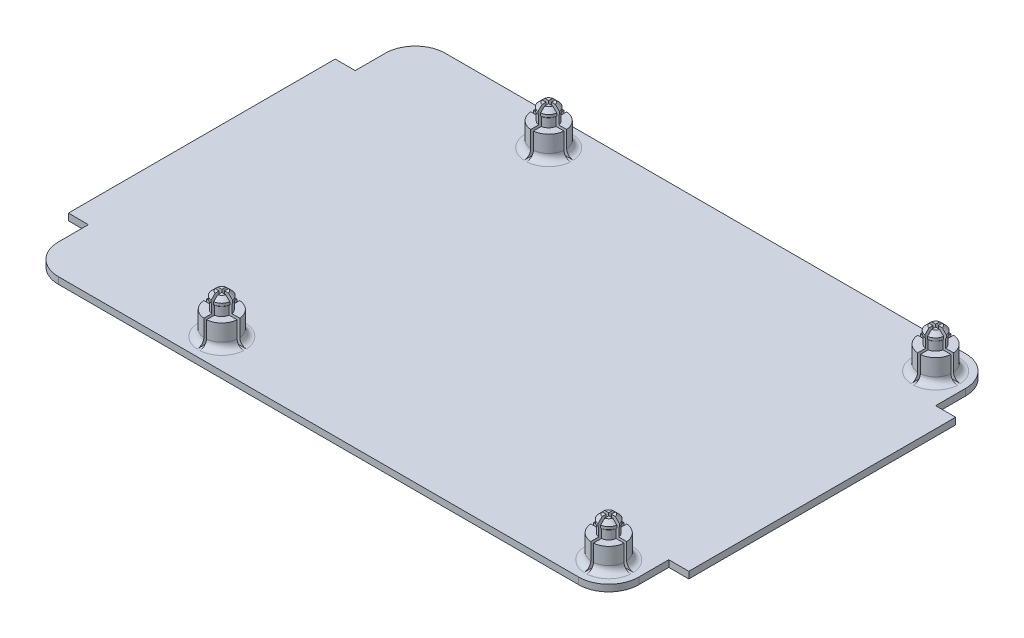
from build123d import *

# Parameters (mm, degrees)
SKETCH1_W           = 87
SKETCH1_H           = 58
BOSS_EXTRUDE1_DEPTH = 1
SKETCH2_R           = 2.5
BOSS_EXTRUDE2_DEPTH = 3.5
SKETCH3_R           = 1.325
BOSS_EXTRUDE3_DEPTH = 1.4
SKETCH4_R           = 1.425
BOSS_EXTRUDE4_DEPTH = 1
CHAMFER2_SIZE       = 0.1
CHAMFER1_SIZE       = 0.6
CUT_EXTRUDE1_REACH  = 54.734
SKETCH5_W           = 63
SKETCH5_H           = 0.4
SKETCH5_W_2         = 0.4
SKETCH5_H_2         = 54
FILLET2_R           = 1
FILLET3_R           = 4.5
SKETCH6_W           = 93
SKETCH6_H           = 40
BOSS_EXTRUDE5_DEPTH = 1


# Some blends are built 0.0001 mm under size
with BuildPart() as part:
    # Sketch1 → Boss-Extrude1 (new body)
    with BuildSketch(Plane(origin=(0, 0, 0), x_dir=(1, 0, 0), z_dir=(0, 1, 0))):
        Rectangle(SKETCH1_W, SKETCH1_H)
    extrude(amount=BOSS_EXTRUDE1_DEPTH)

    # Sketch2 → Boss-Extrude2 (add)
    with BuildSketch(Plane(origin=(0, 1, 0), x_dir=(1, 0, 0), z_dir=(0, 1, 0))):
        with Locations(Location((-19, 24.5, 0), (0, 0, 270))):
            Circle(SKETCH2_R)
        with Locations(Location((39, 24.5, 0), (0, 0, 270))):
            Circle(SKETCH2_R)
        with Locations(Location((39, -24.5, 0), (0, 0, 270))):
            Circle(SKETCH2_R)
        with Locations(Location((-19, -24.5, 0), (0, 0, 270))):
            Circle(SKETCH2_R)
    extrude(amount=BOSS_EXTRUDE2_DEPTH)

    # Sketch3 → Boss-Extrude3 (add)
    with BuildSketch(Plane(origin=(0, 4.5, 0), x_dir=(1, 0, 0), z_dir=(0, 1, 0))):
        with Locations(Location((-19, 24.5, 0), (0, 0, 270))):
            Circle(SKETCH3_R)
        with Locations(Location((39, 24.5, 0), (0, 0, 270))):
            Circle(SKETCH3_R)
        with Locations(Location((39, -24.5, 0), (0, 0, 270))):
            Circle(SKETCH3_R)
        with Locations(Location((-19, -24.5, 0), (0, 0, 270))):
            Circle(SKETCH3_R)
    extrude(amount=BOSS_EXTRUDE3_DEPTH)

    # Sketch4 → Boss-Extrude4 (add)
    with BuildSketch(Plane(origin=(0, 5.9, 0), x_dir=(1, 0, 0), z_dir=(0, 1, 0))):
        with Locations(Location((-19, 24.5, 0), (0, 0, 270))):
            Circle(SKETCH4_R)
        with Locations(Location((39, 24.5, 0), (0, 0, 270))):
            Circle(SKETCH4_R)
        with Locations(Location((39, -24.5, 0), (0, 0, 270))):
            Circle(SKETCH4_R)
        with Locations(Location((-19, -24.5, 0), (0, 0, 270))):
            Circle(SKETCH4_R)
    extrude(amount=BOSS_EXTRUDE4_DEPTH)

    # Chamfer2
    chamfer2_edges = [part.edges().sort_by_distance(p)[0] for p in [
        (-19, 5.9, -25.825),
        (39, 5.9, -25.825),
        (39, 5.9, 23.175),
        (-19, 5.9, 23.175),
    ]]
    chamfer(chamfer2_edges, length=CHAMFER2_SIZE - 0.0001)  # a hair under: the kernel refuses the full size

    # Chamfer1
    chamfer1_edges = [part.edges().sort_by_distance(p)[0] for p in [
        (-19, 6.9, -25.925),
        (39, 6.9, -25.925),
        (39, 6.9, 23.075),
        (-19, 6.9, 23.075),
    ]]
    chamfer(chamfer1_edges, length=CHAMFER1_SIZE)

    # Cut-Extrude1: up to this face of the body (flat: up to its plane)
    cut_extrude1_end = Plane(part.part.faces().sort_by_distance((-0.158108598, 1, 0))[0])
    # Sketch5 → Cut-Extrude1 (cut, up to the picked face)
    with BuildSketch(Plane(origin=(0, 6.9, 0), x_dir=(1, 0, 0), z_dir=(0, 1, 0)), mode=Mode.PRIVATE) as cut_extrude1_sk1:
        with Locations((10, 24.5)):
            Rectangle(SKETCH5_W, SKETCH5_H)
    cut_extrude1_tool1 = split(extrude(cut_extrude1_sk1.sketch, amount=-CUT_EXTRUDE1_REACH, mode=Mode.PRIVATE), bisect_by=cut_extrude1_end, keep=Keep.BOTH, mode=Mode.PRIVATE)
    # Sketch5 → Cut-Extrude1 (cut, up to the picked face)
    with BuildSketch(Plane(origin=(0, 6.9, 0), x_dir=(1, 0, 0), z_dir=(0, 1, 0)), mode=Mode.PRIVATE) as cut_extrude1_sk2:
        with Locations((-19, 0)):
            Rectangle(SKETCH5_W_2, SKETCH5_H_2)
    cut_extrude1_tool2 = split(extrude(cut_extrude1_sk2.sketch, amount=-CUT_EXTRUDE1_REACH, mode=Mode.PRIVATE), bisect_by=cut_extrude1_end, keep=Keep.BOTH, mode=Mode.PRIVATE)
    # Sketch5 → Cut-Extrude1 (cut, up to the picked face)
    with BuildSketch(Plane(origin=(0, 6.9, 0), x_dir=(1, 0, 0), z_dir=(0, 1, 0)), mode=Mode.PRIVATE) as cut_extrude1_sk3:
        with Locations((10, -24.5)):
            Rectangle(SKETCH5_W, SKETCH5_H)
    cut_extrude1_tool3 = split(extrude(cut_extrude1_sk3.sketch, amount=-CUT_EXTRUDE1_REACH, mode=Mode.PRIVATE), bisect_by=cut_extrude1_end, keep=Keep.BOTH, mode=Mode.PRIVATE)
    # Sketch5 → Cut-Extrude1 (cut, up to the picked face)
    with BuildSketch(Plane(origin=(0, 6.9, 0), x_dir=(1, 0, 0), z_dir=(0, 1, 0)), mode=Mode.PRIVATE) as cut_extrude1_sk4:
        with Locations((39, 0)):
            Rectangle(SKETCH5_W_2, SKETCH5_H_2)
    cut_extrude1_tool4 = split(extrude(cut_extrude1_sk4.sketch, amount=-CUT_EXTRUDE1_REACH, mode=Mode.PRIVATE), bisect_by=cut_extrude1_end, keep=Keep.BOTH, mode=Mode.PRIVATE)
    add(cut_extrude1_tool1.solids().sort_by(Axis((10, 6.9, -24.5), (0, -1, 0)))[0], mode=Mode.SUBTRACT)
    add(cut_extrude1_tool2.solids().sort_by(Axis((-19, 6.9, 0), (0, -1, 0)))[0], mode=Mode.SUBTRACT)
    add(cut_extrude1_tool3.solids().sort_by(Axis((10, 6.9, 24.5), (0, -1, 0)))[0], mode=Mode.SUBTRACT)
    add(cut_extrude1_tool4.solids().sort_by(Axis((39, 6.9, 0), (0, -1, 0)))[0], mode=Mode.SUBTRACT)

    # Fillet2
    # the kernel refuses this fillet: 1 mm, written as the material it adds along each edge
    with BuildSketch(Plane(origin=(-19, 1, -24.5), x_dir=(-0.7957460033885471, 0, 0.6056304963351453), z_dir=(-0.6056304963351453, 0, -0.7957460033885471))) as fillet2_piece_1_section:
        with BuildLine():
            CenterArc((2.5 + FILLET2_R, FILLET2_R), FILLET2_R, 180, 90)
            Line((2.5, FILLET2_R), (2.5, 0))
            Line((2.5, 0), (2.5 + FILLET2_R, 0))
        make_face()
    fillet2_piece_1 = revolve(axis=Axis((-19, 1, -24.5), (0, 1, 0)), revolution_arc=195.451548852, mode=Mode.PRIVATE)
    fillet2_piece_1 = split(fillet2_piece_1, bisect_by=Plane(origin=(-19.2, 1.215112732, -22.164691675), z_dir=(-1, 0, 0)), keep=Keep.TOP, mode=Mode.PRIVATE)
    add(fillet2_piece_1)
    with BuildSketch(Plane(origin=(-19, 1, -24.5), x_dir=(-0.7957460033885471, 0, 0.6056304963351453), z_dir=(-0.6056304963351453, 0, -0.7957460033885471))) as fillet2_piece_2_section:
        with BuildLine():
            CenterArc((2.5 + FILLET2_R, FILLET2_R), FILLET2_R, 180, 90)
            Line((2.5, FILLET2_R), (2.5, 0))
            Line((2.5, 0), (2.5 + FILLET2_R, 0))
        make_face()
    fillet2_piece_2 = revolve(axis=Axis((-19, 1, -24.5), (0, 1, 0)), revolution_arc=195.451548852, mode=Mode.PRIVATE)
    fillet2_piece_2 = split(fillet2_piece_2, bisect_by=Plane(origin=(-17.223802717, 1.214987544, -24.3), z_dir=(0, 0, 1)), keep=Keep.TOP, mode=Mode.PRIVATE)
    fillet2_piece_2 = split(fillet2_piece_2, bisect_by=Plane(origin=(-18.8, 1.214987544, -22.723801928), z_dir=(1, 0, 0)), keep=Keep.TOP, mode=Mode.PRIVATE)
    add(fillet2_piece_2)
    with BuildSketch(Plane(origin=(-19, 1, -24.5), x_dir=(-0.7957460033885471, 0, 0.6056304963351453), z_dir=(-0.6056304963351453, 0, -0.7957460033885471))) as fillet2_piece_3_section:
        with BuildLine():
            CenterArc((2.5 + FILLET2_R, FILLET2_R), FILLET2_R, 180, 90)
            Line((2.5, FILLET2_R), (2.5, 0))
            Line((2.5, 0), (2.5 + FILLET2_R, 0))
        make_face()
    fillet2_piece_3 = revolve(axis=Axis((-19, 1, -24.5), (0, 1, 0)), revolution_arc=195.451548852, mode=Mode.PRIVATE)
    fillet2_piece_3 = split(fillet2_piece_3, bisect_by=Plane(origin=(-16.664691443, 1.215113002, -24.7), z_dir=(0, 0, -1)), keep=Keep.TOP, mode=Mode.PRIVATE)
    add(fillet2_piece_3)
    with BuildSketch(Plane(origin=(39, 1, -24.5), x_dir=(-0.7957460033885464, 0, 0.6056304963351462), z_dir=(-0.6056304963351462, 0, -0.7957460033885464))) as fillet2_piece_4_section:
        with BuildLine():
            CenterArc((2.5 + FILLET2_R, FILLET2_R), FILLET2_R, 180, 90)
            Line((2.5, FILLET2_R), (2.5, 0))
            Line((2.5, 0), (2.5 + FILLET2_R, 0))
        make_face()
    fillet2_piece_4 = revolve(axis=Axis((39, 1, -24.5), (0, 1, 0)), revolution_arc=195.451548852, mode=Mode.PRIVATE)
    fillet2_piece_4 = split(fillet2_piece_4, bisect_by=Plane(origin=(38.8, 1.215112732, -22.164691675), z_dir=(-1, 0, 0)), keep=Keep.TOP, mode=Mode.PRIVATE)
    add(fillet2_piece_4)
    with BuildSketch(Plane(origin=(39, 1, -24.5), x_dir=(-0.7957460033885464, 0, 0.6056304963351462), z_dir=(-0.6056304963351462, 0, -0.7957460033885464))) as fillet2_piece_5_section:
        with BuildLine():
            CenterArc((2.5 + FILLET2_R, FILLET2_R), FILLET2_R, 180, 90)
            Line((2.5, FILLET2_R), (2.5, 0))
            Line((2.5, 0), (2.5 + FILLET2_R, 0))
        make_face()
    fillet2_piece_5 = revolve(axis=Axis((39, 1, -24.5), (0, 1, 0)), revolution_arc=195.451548852, mode=Mode.PRIVATE)
    fillet2_piece_5 = split(fillet2_piece_5, bisect_by=Plane(origin=(40.776197283, 1.214987544, -24.3), z_dir=(0, 0, 1)), keep=Keep.TOP, mode=Mode.PRIVATE)
    fillet2_piece_5 = split(fillet2_piece_5, bisect_by=Plane(origin=(39.2, 1.214987544, -22.723801928), z_dir=(1, 0, 0)), keep=Keep.TOP, mode=Mode.PRIVATE)
    add(fillet2_piece_5)
    with BuildSketch(Plane(origin=(39, 1, -24.5), x_dir=(-0.7957460033885464, 0, 0.6056304963351462), z_dir=(-0.6056304963351462, 0, -0.7957460033885464))) as fillet2_piece_6_section:
        with BuildLine():
            CenterArc((2.5 + FILLET2_R, FILLET2_R), FILLET2_R, 180, 90)
            Line((2.5, FILLET2_R), (2.5, 0))
            Line((2.5, 0), (2.5 + FILLET2_R, 0))
        make_face()
    fillet2_piece_6 = revolve(axis=Axis((39, 1, -24.5), (0, 1, 0)), revolution_arc=195.451548852, mode=Mode.PRIVATE)
    fillet2_piece_6 = split(fillet2_piece_6, bisect_by=Plane(origin=(41.335308557, 1.215113002, -24.7), z_dir=(0, 0, -1)), keep=Keep.TOP, mode=Mode.PRIVATE)
    add(fillet2_piece_6)
    with BuildSketch(Plane(origin=(-19, 1, 24.5), x_dir=(-0.7957460033885471, 0, 0.6056304963351453), z_dir=(-0.6056304963351453, 0, -0.7957460033885471))) as fillet2_piece_7_section:
        with BuildLine():
            CenterArc((2.5 + FILLET2_R, FILLET2_R), FILLET2_R, 180, 90)
            Line((2.5, FILLET2_R), (2.5, 0))
            Line((2.5, 0), (2.5 + FILLET2_R, 0))
        make_face()
    fillet2_piece_7 = revolve(axis=Axis((-19, 1, 24.5), (0, 1, 0)), revolution_arc=195.451548852, mode=Mode.PRIVATE)
    fillet2_piece_7 = split(fillet2_piece_7, bisect_by=Plane(origin=(-19.2, 1.215112732, 26.835308325), z_dir=(-1, 0, 0)), keep=Keep.TOP, mode=Mode.PRIVATE)
    add(fillet2_piece_7)
    with BuildSketch(Plane(origin=(-19, 1, 24.5), x_dir=(-0.7957460033885471, 0, 0.6056304963351453), z_dir=(-0.6056304963351453, 0, -0.7957460033885471))) as fillet2_piece_8_section:
        with BuildLine():
            CenterArc((2.5 + FILLET2_R, FILLET2_R), FILLET2_R, 180, 90)
            Line((2.5, FILLET2_R), (2.5, 0))
            Line((2.5, 0), (2.5 + FILLET2_R, 0))
        make_face()
    fillet2_piece_8 = revolve(axis=Axis((-19, 1, 24.5), (0, 1, 0)), revolution_arc=195.451548852, mode=Mode.PRIVATE)
    fillet2_piece_8 = split(fillet2_piece_8, bisect_by=Plane(origin=(-17.223802717, 1.214987544, 24.7), z_dir=(0, 0, 1)), keep=Keep.TOP, mode=Mode.PRIVATE)
    fillet2_piece_8 = split(fillet2_piece_8, bisect_by=Plane(origin=(-18.8, 1.214987544, 26.276198072), z_dir=(1, 0, 0)), keep=Keep.TOP, mode=Mode.PRIVATE)
    add(fillet2_piece_8)
    with BuildSketch(Plane(origin=(-19, 1, 24.5), x_dir=(-0.7957460033885471, 0, 0.6056304963351453), z_dir=(-0.6056304963351453, 0, -0.7957460033885471))) as fillet2_piece_9_section:
        with BuildLine():
            CenterArc((2.5 + FILLET2_R, FILLET2_R), FILLET2_R, 180, 90)
            Line((2.5, FILLET2_R), (2.5, 0))
            Line((2.5, 0), (2.5 + FILLET2_R, 0))
        make_face()
    fillet2_piece_9 = revolve(axis=Axis((-19, 1, 24.5), (0, 1, 0)), revolution_arc=195.451548852, mode=Mode.PRIVATE)
    fillet2_piece_9 = split(fillet2_piece_9, bisect_by=Plane(origin=(-16.664691443, 1.215113002, 24.3), z_dir=(0, 0, -1)), keep=Keep.TOP, mode=Mode.PRIVATE)
    add(fillet2_piece_9)
    with BuildSketch(Plane(origin=(-19, 1, 24.5), x_dir=(0.6056304963351372, 0, 0.7957460033885533), z_dir=(-0.7957460033885533, 0, 0.6056304963351372))) as fillet2_piece_10_section:
        with BuildLine():
            CenterArc((2.5 + FILLET2_R, FILLET2_R), FILLET2_R, 180, 90)
            Line((2.5, FILLET2_R), (2.5, 0))
            Line((2.5, 0), (2.5 + FILLET2_R, 0))
        make_face()
    fillet2_piece_10 = revolve(axis=Axis((-19, 1, 24.5), (0, 1, 0)), revolution_arc=195.451548852, mode=Mode.PRIVATE)
    fillet2_piece_10 = split(fillet2_piece_10, bisect_by=Plane(origin=(-16.664691675, 1.215112732, 24.7), z_dir=(0, 0, 1)), keep=Keep.TOP, mode=Mode.PRIVATE)
    add(fillet2_piece_10)
    with BuildSketch(Plane(origin=(-19, 1, 24.5), x_dir=(0.6056304963351372, 0, 0.7957460033885533), z_dir=(-0.7957460033885533, 0, 0.6056304963351372))) as fillet2_piece_11_section:
        with BuildLine():
            CenterArc((2.5 + FILLET2_R, FILLET2_R), FILLET2_R, 180, 90)
            Line((2.5, FILLET2_R), (2.5, 0))
            Line((2.5, 0), (2.5 + FILLET2_R, 0))
        make_face()
    fillet2_piece_11 = revolve(axis=Axis((-19, 1, 24.5), (0, 1, 0)), revolution_arc=195.451548852, mode=Mode.PRIVATE)
    fillet2_piece_11 = split(fillet2_piece_11, bisect_by=Plane(origin=(-18.8, 1.214987544, 22.723802717), z_dir=(1, 0, 0)), keep=Keep.TOP, mode=Mode.PRIVATE)
    fillet2_piece_11 = split(fillet2_piece_11, bisect_by=Plane(origin=(-17.223801928, 1.214987544, 24.3), z_dir=(0, 0, -1)), keep=Keep.TOP, mode=Mode.PRIVATE)
    add(fillet2_piece_11)
    with BuildSketch(Plane(origin=(-19, 1, 24.5), x_dir=(0.6056304963351372, 0, 0.7957460033885533), z_dir=(-0.7957460033885533, 0, 0.6056304963351372))) as fillet2_piece_12_section:
        with BuildLine():
            CenterArc((2.5 + FILLET2_R, FILLET2_R), FILLET2_R, 180, 90)
            Line((2.5, FILLET2_R), (2.5, 0))
            Line((2.5, 0), (2.5 + FILLET2_R, 0))
        make_face()
    fillet2_piece_12 = revolve(axis=Axis((-19, 1, 24.5), (0, 1, 0)), revolution_arc=195.451548852, mode=Mode.PRIVATE)
    fillet2_piece_12 = split(fillet2_piece_12, bisect_by=Plane(origin=(-19.2, 1.215113002, 22.164691443), z_dir=(-1, 0, 0)), keep=Keep.TOP, mode=Mode.PRIVATE)
    add(fillet2_piece_12)
    with BuildSketch(Plane(origin=(-19, 1, 24.5), x_dir=(0.7957460033885317, 0, -0.6056304963351654), z_dir=(0.6056304963351654, 0, 0.7957460033885317))) as fillet2_piece_13_section:
        with BuildLine():
            CenterArc((2.5 + FILLET2_R, FILLET2_R), FILLET2_R, 180, 90)
            Line((2.5, FILLET2_R), (2.5, 0))
            Line((2.5, 0), (2.5 + FILLET2_R, 0))
        make_face()
    fillet2_piece_13 = revolve(axis=Axis((-19, 1, 24.5), (0, 1, 0)), revolution_arc=195.451548852, mode=Mode.PRIVATE)
    fillet2_piece_13 = split(fillet2_piece_13, bisect_by=Plane(origin=(-18.8, 1.215112732, 22.164691675), z_dir=(1, 0, 0)), keep=Keep.TOP, mode=Mode.PRIVATE)
    add(fillet2_piece_13)
    with BuildSketch(Plane(origin=(-19, 1, 24.5), x_dir=(0.7957460033885317, 0, -0.6056304963351654), z_dir=(0.6056304963351654, 0, 0.7957460033885317))) as fillet2_piece_14_section:
        with BuildLine():
            CenterArc((2.5 + FILLET2_R, FILLET2_R), FILLET2_R, 180, 90)
            Line((2.5, FILLET2_R), (2.5, 0))
            Line((2.5, 0), (2.5 + FILLET2_R, 0))
        make_face()
    fillet2_piece_14 = revolve(axis=Axis((-19, 1, 24.5), (0, 1, 0)), revolution_arc=195.451548852, mode=Mode.PRIVATE)
    fillet2_piece_14 = split(fillet2_piece_14, bisect_by=Plane(origin=(-20.776197283, 1.214987544, 24.3), z_dir=(0, 0, -1)), keep=Keep.TOP, mode=Mode.PRIVATE)
    fillet2_piece_14 = split(fillet2_piece_14, bisect_by=Plane(origin=(-19.2, 1.214987544, 22.723801928), z_dir=(-1, 0, 0)), keep=Keep.TOP, mode=Mode.PRIVATE)
    add(fillet2_piece_14)
    with BuildSketch(Plane(origin=(-19, 1, 24.5), x_dir=(0.7957460033885317, 0, -0.6056304963351654), z_dir=(0.6056304963351654, 0, 0.7957460033885317))) as fillet2_piece_15_section:
        with BuildLine():
            CenterArc((2.5 + FILLET2_R, FILLET2_R), FILLET2_R, 180, 90)
            Line((2.5, FILLET2_R), (2.5, 0))
            Line((2.5, 0), (2.5 + FILLET2_R, 0))
        make_face()
    fillet2_piece_15 = revolve(axis=Axis((-19, 1, 24.5), (0, 1, 0)), revolution_arc=195.451548852, mode=Mode.PRIVATE)
    fillet2_piece_15 = split(fillet2_piece_15, bisect_by=Plane(origin=(-21.335308557, 1.215113002, 24.7), z_dir=(0, 0, 1)), keep=Keep.TOP, mode=Mode.PRIVATE)
    add(fillet2_piece_15)
    with BuildSketch(Plane(origin=(-19, 1, 24.5), x_dir=(-0.60563049633518, 0, -0.7957460033885208), z_dir=(0.7957460033885208, 0, -0.60563049633518))) as fillet2_piece_16_section:
        with BuildLine():
            CenterArc((2.5 + FILLET2_R, FILLET2_R), FILLET2_R, 180, 90)
            Line((2.5, FILLET2_R), (2.5, 0))
            Line((2.5, 0), (2.5 + FILLET2_R, 0))
        make_face()
    fillet2_piece_16 = revolve(axis=Axis((-19, 1, 24.5), (0, 1, 0)), revolution_arc=195.451548852, mode=Mode.PRIVATE)
    fillet2_piece_16 = split(fillet2_piece_16, bisect_by=Plane(origin=(-21.335308325, 1.215112732, 24.3), z_dir=(0, 0, -1)), keep=Keep.TOP, mode=Mode.PRIVATE)
    add(fillet2_piece_16)
    with BuildSketch(Plane(origin=(-19, 1, 24.5), x_dir=(-0.60563049633518, 0, -0.7957460033885208), z_dir=(0.7957460033885208, 0, -0.60563049633518))) as fillet2_piece_17_section:
        with BuildLine():
            CenterArc((2.5 + FILLET2_R, FILLET2_R), FILLET2_R, 180, 90)
            Line((2.5, FILLET2_R), (2.5, 0))
            Line((2.5, 0), (2.5 + FILLET2_R, 0))
        make_face()
    fillet2_piece_17 = revolve(axis=Axis((-19, 1, 24.5), (0, 1, 0)), revolution_arc=195.451548852, mode=Mode.PRIVATE)
    fillet2_piece_17 = split(fillet2_piece_17, bisect_by=Plane(origin=(-19.2, 1.214987544, 26.276197283), z_dir=(-1, 0, 0)), keep=Keep.TOP, mode=Mode.PRIVATE)
    fillet2_piece_17 = split(fillet2_piece_17, bisect_by=Plane(origin=(-20.776198072, 1.214987544, 24.7), z_dir=(0, 0, 1)), keep=Keep.TOP, mode=Mode.PRIVATE)
    add(fillet2_piece_17)
    with BuildSketch(Plane(origin=(-19, 1, 24.5), x_dir=(-0.60563049633518, 0, -0.7957460033885208), z_dir=(0.7957460033885208, 0, -0.60563049633518))) as fillet2_piece_18_section:
        with BuildLine():
            CenterArc((2.5 + FILLET2_R, FILLET2_R), FILLET2_R, 180, 90)
            Line((2.5, FILLET2_R), (2.5, 0))
            Line((2.5, 0), (2.5 + FILLET2_R, 0))
        make_face()
    fillet2_piece_18 = revolve(axis=Axis((-19, 1, 24.5), (0, 1, 0)), revolution_arc=195.451548852, mode=Mode.PRIVATE)
    fillet2_piece_18 = split(fillet2_piece_18, bisect_by=Plane(origin=(-18.8, 1.215113002, 26.835308557), z_dir=(1, 0, 0)), keep=Keep.TOP, mode=Mode.PRIVATE)
    add(fillet2_piece_18)
    with BuildSketch(Plane(origin=(39, 1, 24.5), x_dir=(-0.7957460033885464, 0, 0.6056304963351462), z_dir=(-0.6056304963351462, 0, -0.7957460033885464))) as fillet2_piece_19_section:
        with BuildLine():
            CenterArc((2.5 + FILLET2_R, FILLET2_R), FILLET2_R, 180, 90)
            Line((2.5, FILLET2_R), (2.5, 0))
            Line((2.5, 0), (2.5 + FILLET2_R, 0))
        make_face()
    fillet2_piece_19 = revolve(axis=Axis((39, 1, 24.5), (0, 1, 0)), revolution_arc=195.451548852, mode=Mode.PRIVATE)
    fillet2_piece_19 = split(fillet2_piece_19, bisect_by=Plane(origin=(38.8, 1.215112732, 26.835308325), z_dir=(-1, 0, 0)), keep=Keep.TOP, mode=Mode.PRIVATE)
    add(fillet2_piece_19)
    with BuildSketch(Plane(origin=(39, 1, 24.5), x_dir=(-0.7957460033885464, 0, 0.6056304963351462), z_dir=(-0.6056304963351462, 0, -0.7957460033885464))) as fillet2_piece_20_section:
        with BuildLine():
            CenterArc((2.5 + FILLET2_R, FILLET2_R), FILLET2_R, 180, 90)
            Line((2.5, FILLET2_R), (2.5, 0))
            Line((2.5, 0), (2.5 + FILLET2_R, 0))
        make_face()
    fillet2_piece_20 = revolve(axis=Axis((39, 1, 24.5), (0, 1, 0)), revolution_arc=195.451548852, mode=Mode.PRIVATE)
    fillet2_piece_20 = split(fillet2_piece_20, bisect_by=Plane(origin=(40.776197283, 1.214987544, 24.7), z_dir=(0, 0, 1)), keep=Keep.TOP, mode=Mode.PRIVATE)
    fillet2_piece_20 = split(fillet2_piece_20, bisect_by=Plane(origin=(39.2, 1.214987544, 26.276198072), z_dir=(1, 0, 0)), keep=Keep.TOP, mode=Mode.PRIVATE)
    add(fillet2_piece_20)
    with BuildSketch(Plane(origin=(39, 1, 24.5), x_dir=(-0.7957460033885464, 0, 0.6056304963351462), z_dir=(-0.6056304963351462, 0, -0.7957460033885464))) as fillet2_piece_21_section:
        with BuildLine():
            CenterArc((2.5 + FILLET2_R, FILLET2_R), FILLET2_R, 180, 90)
            Line((2.5, FILLET2_R), (2.5, 0))
            Line((2.5, 0), (2.5 + FILLET2_R, 0))
        make_face()
    fillet2_piece_21 = revolve(axis=Axis((39, 1, 24.5), (0, 1, 0)), revolution_arc=195.451548852, mode=Mode.PRIVATE)
    fillet2_piece_21 = split(fillet2_piece_21, bisect_by=Plane(origin=(41.335308557, 1.215113002, 24.3), z_dir=(0, 0, -1)), keep=Keep.TOP, mode=Mode.PRIVATE)
    add(fillet2_piece_21)
    with BuildSketch(Plane(origin=(39, 1, 24.5), x_dir=(0.6056304963351349, 0, 0.7957460033885551), z_dir=(-0.7957460033885551, 0, 0.6056304963351349))) as fillet2_piece_22_section:
        with BuildLine():
            CenterArc((2.5 + FILLET2_R, FILLET2_R), FILLET2_R, 180, 90)
            Line((2.5, FILLET2_R), (2.5, 0))
            Line((2.5, 0), (2.5 + FILLET2_R, 0))
        make_face()
    fillet2_piece_22 = revolve(axis=Axis((39, 1, 24.5), (0, 1, 0)), revolution_arc=195.451548852, mode=Mode.PRIVATE)
    fillet2_piece_22 = split(fillet2_piece_22, bisect_by=Plane(origin=(41.335308325, 1.215112732, 24.7), z_dir=(0, 0, 1)), keep=Keep.TOP, mode=Mode.PRIVATE)
    add(fillet2_piece_22)
    with BuildSketch(Plane(origin=(39, 1, 24.5), x_dir=(0.6056304963351349, 0, 0.7957460033885551), z_dir=(-0.7957460033885551, 0, 0.6056304963351349))) as fillet2_piece_23_section:
        with BuildLine():
            CenterArc((2.5 + FILLET2_R, FILLET2_R), FILLET2_R, 180, 90)
            Line((2.5, FILLET2_R), (2.5, 0))
            Line((2.5, 0), (2.5 + FILLET2_R, 0))
        make_face()
    fillet2_piece_23 = revolve(axis=Axis((39, 1, 24.5), (0, 1, 0)), revolution_arc=195.451548852, mode=Mode.PRIVATE)
    fillet2_piece_23 = split(fillet2_piece_23, bisect_by=Plane(origin=(39.2, 1.214987544, 22.723802717), z_dir=(1, 0, 0)), keep=Keep.TOP, mode=Mode.PRIVATE)
    fillet2_piece_23 = split(fillet2_piece_23, bisect_by=Plane(origin=(40.776198072, 1.214987544, 24.3), z_dir=(0, 0, -1)), keep=Keep.TOP, mode=Mode.PRIVATE)
    add(fillet2_piece_23)
    with BuildSketch(Plane(origin=(39, 1, 24.5), x_dir=(0.6056304963351349, 0, 0.7957460033885551), z_dir=(-0.7957460033885551, 0, 0.6056304963351349))) as fillet2_piece_24_section:
        with BuildLine():
            CenterArc((2.5 + FILLET2_R, FILLET2_R), FILLET2_R, 180, 90)
            Line((2.5, FILLET2_R), (2.5, 0))
            Line((2.5, 0), (2.5 + FILLET2_R, 0))
        make_face()
    fillet2_piece_24 = revolve(axis=Axis((39, 1, 24.5), (0, 1, 0)), revolution_arc=195.451548852, mode=Mode.PRIVATE)
    fillet2_piece_24 = split(fillet2_piece_24, bisect_by=Plane(origin=(38.8, 1.215113002, 22.164691443), z_dir=(-1, 0, 0)), keep=Keep.TOP, mode=Mode.PRIVATE)
    add(fillet2_piece_24)
    with BuildSketch(Plane(origin=(39, 1, 24.5), x_dir=(0.795746003388534, 0, -0.6056304963351625), z_dir=(0.6056304963351625, 0, 0.795746003388534))) as fillet2_piece_25_section:
        with BuildLine():
            CenterArc((2.5 + FILLET2_R, FILLET2_R), FILLET2_R, 180, 90)
            Line((2.5, FILLET2_R), (2.5, 0))
            Line((2.5, 0), (2.5 + FILLET2_R, 0))
        make_face()
    fillet2_piece_25 = revolve(axis=Axis((39, 1, 24.5), (0, 1, 0)), revolution_arc=195.451548852, mode=Mode.PRIVATE)
    fillet2_piece_25 = split(fillet2_piece_25, bisect_by=Plane(origin=(39.2, 1.215112732, 22.164691675), z_dir=(1, 0, 0)), keep=Keep.TOP, mode=Mode.PRIVATE)
    add(fillet2_piece_25)
    with BuildSketch(Plane(origin=(39, 1, 24.5), x_dir=(0.795746003388534, 0, -0.6056304963351625), z_dir=(0.6056304963351625, 0, 0.795746003388534))) as fillet2_piece_26_section:
        with BuildLine():
            CenterArc((2.5 + FILLET2_R, FILLET2_R), FILLET2_R, 180, 90)
            Line((2.5, FILLET2_R), (2.5, 0))
            Line((2.5, 0), (2.5 + FILLET2_R, 0))
        make_face()
    fillet2_piece_26 = revolve(axis=Axis((39, 1, 24.5), (0, 1, 0)), revolution_arc=195.451548852, mode=Mode.PRIVATE)
    fillet2_piece_26 = split(fillet2_piece_26, bisect_by=Plane(origin=(37.223802717, 1.214987544, 24.3), z_dir=(0, 0, -1)), keep=Keep.TOP, mode=Mode.PRIVATE)
    fillet2_piece_26 = split(fillet2_piece_26, bisect_by=Plane(origin=(38.8, 1.214987544, 22.723801928), z_dir=(-1, 0, 0)), keep=Keep.TOP, mode=Mode.PRIVATE)
    add(fillet2_piece_26)
    with BuildSketch(Plane(origin=(39, 1, 24.5), x_dir=(0.795746003388534, 0, -0.6056304963351625), z_dir=(0.6056304963351625, 0, 0.795746003388534))) as fillet2_piece_27_section:
        with BuildLine():
            CenterArc((2.5 + FILLET2_R, FILLET2_R), FILLET2_R, 180, 90)
            Line((2.5, FILLET2_R), (2.5, 0))
            Line((2.5, 0), (2.5 + FILLET2_R, 0))
        make_face()
    fillet2_piece_27 = revolve(axis=Axis((39, 1, 24.5), (0, 1, 0)), revolution_arc=195.451548852, mode=Mode.PRIVATE)
    fillet2_piece_27 = split(fillet2_piece_27, bisect_by=Plane(origin=(36.664691443, 1.215113002, 24.7), z_dir=(0, 0, 1)), keep=Keep.TOP, mode=Mode.PRIVATE)
    add(fillet2_piece_27)
    with BuildSketch(Plane(origin=(39, 1, 24.5), x_dir=(-0.6056304963351833, 0, -0.7957460033885181), z_dir=(0.7957460033885181, 0, -0.6056304963351833))) as fillet2_piece_28_section:
        with BuildLine():
            CenterArc((2.5 + FILLET2_R, FILLET2_R), FILLET2_R, 180, 90)
            Line((2.5, FILLET2_R), (2.5, 0))
            Line((2.5, 0), (2.5 + FILLET2_R, 0))
        make_face()
    fillet2_piece_28 = revolve(axis=Axis((39, 1, 24.5), (0, 1, 0)), revolution_arc=195.451548852, mode=Mode.PRIVATE)
    fillet2_piece_28 = split(fillet2_piece_28, bisect_by=Plane(origin=(36.664691675, 1.215112732, 24.3), z_dir=(0, 0, -1)), keep=Keep.TOP, mode=Mode.PRIVATE)
    add(fillet2_piece_28)
    with BuildSketch(Plane(origin=(39, 1, 24.5), x_dir=(-0.6056304963351833, 0, -0.7957460033885181), z_dir=(0.7957460033885181, 0, -0.6056304963351833))) as fillet2_piece_29_section:
        with BuildLine():
            CenterArc((2.5 + FILLET2_R, FILLET2_R), FILLET2_R, 180, 90)
            Line((2.5, FILLET2_R), (2.5, 0))
            Line((2.5, 0), (2.5 + FILLET2_R, 0))
        make_face()
    fillet2_piece_29 = revolve(axis=Axis((39, 1, 24.5), (0, 1, 0)), revolution_arc=195.451548852, mode=Mode.PRIVATE)
    fillet2_piece_29 = split(fillet2_piece_29, bisect_by=Plane(origin=(38.8, 1.214987544, 26.276197283), z_dir=(-1, 0, 0)), keep=Keep.TOP, mode=Mode.PRIVATE)
    fillet2_piece_29 = split(fillet2_piece_29, bisect_by=Plane(origin=(37.223801928, 1.214987544, 24.7), z_dir=(0, 0, 1)), keep=Keep.TOP, mode=Mode.PRIVATE)
    add(fillet2_piece_29)
    with BuildSketch(Plane(origin=(39, 1, 24.5), x_dir=(-0.6056304963351833, 0, -0.7957460033885181), z_dir=(0.7957460033885181, 0, -0.6056304963351833))) as fillet2_piece_30_section:
        with BuildLine():
            CenterArc((2.5 + FILLET2_R, FILLET2_R), FILLET2_R, 180, 90)
            Line((2.5, FILLET2_R), (2.5, 0))
            Line((2.5, 0), (2.5 + FILLET2_R, 0))
        make_face()
    fillet2_piece_30 = revolve(axis=Axis((39, 1, 24.5), (0, 1, 0)), revolution_arc=195.451548852, mode=Mode.PRIVATE)
    fillet2_piece_30 = split(fillet2_piece_30, bisect_by=Plane(origin=(39.2, 1.215113002, 26.835308557), z_dir=(1, 0, 0)), keep=Keep.TOP, mode=Mode.PRIVATE)
    add(fillet2_piece_30)
    with BuildSketch(Plane(origin=(39, 1, -24.5), x_dir=(0.6056304963351349, 0, 0.7957460033885551), z_dir=(-0.7957460033885551, 0, 0.6056304963351349))) as fillet2_piece_31_section:
        with BuildLine():
            CenterArc((2.5 + FILLET2_R, FILLET2_R), FILLET2_R, 180, 90)
            Line((2.5, FILLET2_R), (2.5, 0))
            Line((2.5, 0), (2.5 + FILLET2_R, 0))
        make_face()
    fillet2_piece_31 = revolve(axis=Axis((39, 1, -24.5), (0, 1, 0)), revolution_arc=195.451548852, mode=Mode.PRIVATE)
    fillet2_piece_31 = split(fillet2_piece_31, bisect_by=Plane(origin=(41.335308325, 1.215112732, -24.3), z_dir=(0, 0, 1)), keep=Keep.TOP, mode=Mode.PRIVATE)
    add(fillet2_piece_31)
    with BuildSketch(Plane(origin=(39, 1, -24.5), x_dir=(0.6056304963351349, 0, 0.7957460033885551), z_dir=(-0.7957460033885551, 0, 0.6056304963351349))) as fillet2_piece_32_section:
        with BuildLine():
            CenterArc((2.5 + FILLET2_R, FILLET2_R), FILLET2_R, 180, 90)
            Line((2.5, FILLET2_R), (2.5, 0))
            Line((2.5, 0), (2.5 + FILLET2_R, 0))
        make_face()
    fillet2_piece_32 = revolve(axis=Axis((39, 1, -24.5), (0, 1, 0)), revolution_arc=195.451548852, mode=Mode.PRIVATE)
    fillet2_piece_32 = split(fillet2_piece_32, bisect_by=Plane(origin=(39.2, 1.214987544, -26.276197283), z_dir=(1, 0, 0)), keep=Keep.TOP, mode=Mode.PRIVATE)
    fillet2_piece_32 = split(fillet2_piece_32, bisect_by=Plane(origin=(40.776198072, 1.214987544, -24.7), z_dir=(0, 0, -1)), keep=Keep.TOP, mode=Mode.PRIVATE)
    add(fillet2_piece_32)
    with BuildSketch(Plane(origin=(39, 1, -24.5), x_dir=(0.6056304963351349, 0, 0.7957460033885551), z_dir=(-0.7957460033885551, 0, 0.6056304963351349))) as fillet2_piece_33_section:
        with BuildLine():
            CenterArc((2.5 + FILLET2_R, FILLET2_R), FILLET2_R, 180, 90)
            Line((2.5, FILLET2_R), (2.5, 0))
            Line((2.5, 0), (2.5 + FILLET2_R, 0))
        make_face()
    fillet2_piece_33 = revolve(axis=Axis((39, 1, -24.5), (0, 1, 0)), revolution_arc=195.451548852, mode=Mode.PRIVATE)
    fillet2_piece_33 = split(fillet2_piece_33, bisect_by=Plane(origin=(38.8, 1.215113002, -26.835308557), z_dir=(-1, 0, 0)), keep=Keep.TOP, mode=Mode.PRIVATE)
    add(fillet2_piece_33)
    with BuildSketch(Plane(origin=(39, 1, -24.5), x_dir=(0.7957460033885316, 0, -0.6056304963351656), z_dir=(0.6056304963351656, 0, 0.7957460033885316))) as fillet2_piece_34_section:
        with BuildLine():
            CenterArc((2.5 + FILLET2_R, FILLET2_R), FILLET2_R, 180, 90)
            Line((2.5, FILLET2_R), (2.5, 0))
            Line((2.5, 0), (2.5 + FILLET2_R, 0))
        make_face()
    fillet2_piece_34 = revolve(axis=Axis((39, 1, -24.5), (0, 1, 0)), revolution_arc=195.451548852, mode=Mode.PRIVATE)
    fillet2_piece_34 = split(fillet2_piece_34, bisect_by=Plane(origin=(39.2, 1.215112732, -26.835308325), z_dir=(1, 0, 0)), keep=Keep.TOP, mode=Mode.PRIVATE)
    add(fillet2_piece_34)
    with BuildSketch(Plane(origin=(39, 1, -24.5), x_dir=(0.7957460033885316, 0, -0.6056304963351656), z_dir=(0.6056304963351656, 0, 0.7957460033885316))) as fillet2_piece_35_section:
        with BuildLine():
            CenterArc((2.5 + FILLET2_R, FILLET2_R), FILLET2_R, 180, 90)
            Line((2.5, FILLET2_R), (2.5, 0))
            Line((2.5, 0), (2.5 + FILLET2_R, 0))
        make_face()
    fillet2_piece_35 = revolve(axis=Axis((39, 1, -24.5), (0, 1, 0)), revolution_arc=195.451548852, mode=Mode.PRIVATE)
    fillet2_piece_35 = split(fillet2_piece_35, bisect_by=Plane(origin=(37.223802717, 1.214987544, -24.7), z_dir=(0, 0, -1)), keep=Keep.TOP, mode=Mode.PRIVATE)
    fillet2_piece_35 = split(fillet2_piece_35, bisect_by=Plane(origin=(38.8, 1.214987544, -26.276198072), z_dir=(-1, 0, 0)), keep=Keep.TOP, mode=Mode.PRIVATE)
    add(fillet2_piece_35)
    with BuildSketch(Plane(origin=(39, 1, -24.5), x_dir=(0.7957460033885316, 0, -0.6056304963351656), z_dir=(0.6056304963351656, 0, 0.7957460033885316))) as fillet2_piece_36_section:
        with BuildLine():
            CenterArc((2.5 + FILLET2_R, FILLET2_R), FILLET2_R, 180, 90)
            Line((2.5, FILLET2_R), (2.5, 0))
            Line((2.5, 0), (2.5 + FILLET2_R, 0))
        make_face()
    fillet2_piece_36 = revolve(axis=Axis((39, 1, -24.5), (0, 1, 0)), revolution_arc=195.451548852, mode=Mode.PRIVATE)
    fillet2_piece_36 = split(fillet2_piece_36, bisect_by=Plane(origin=(36.664691443, 1.215113002, -24.3), z_dir=(0, 0, 1)), keep=Keep.TOP, mode=Mode.PRIVATE)
    add(fillet2_piece_36)
    with BuildSketch(Plane(origin=(39, 1, -24.5), x_dir=(-0.6056304963351826, 0, -0.7957460033885186), z_dir=(0.7957460033885186, 0, -0.6056304963351826))) as fillet2_piece_37_section:
        with BuildLine():
            CenterArc((2.5 + FILLET2_R, FILLET2_R), FILLET2_R, 180, 90)
            Line((2.5, FILLET2_R), (2.5, 0))
            Line((2.5, 0), (2.5 + FILLET2_R, 0))
        make_face()
    fillet2_piece_37 = revolve(axis=Axis((39, 1, -24.5), (0, 1, 0)), revolution_arc=195.451548852, mode=Mode.PRIVATE)
    fillet2_piece_37 = split(fillet2_piece_37, bisect_by=Plane(origin=(36.664691675, 1.215112732, -24.7), z_dir=(0, 0, -1)), keep=Keep.TOP, mode=Mode.PRIVATE)
    add(fillet2_piece_37)
    with BuildSketch(Plane(origin=(39, 1, -24.5), x_dir=(-0.6056304963351826, 0, -0.7957460033885186), z_dir=(0.7957460033885186, 0, -0.6056304963351826))) as fillet2_piece_38_section:
        with BuildLine():
            CenterArc((2.5 + FILLET2_R, FILLET2_R), FILLET2_R, 180, 90)
            Line((2.5, FILLET2_R), (2.5, 0))
            Line((2.5, 0), (2.5 + FILLET2_R, 0))
        make_face()
    fillet2_piece_38 = revolve(axis=Axis((39, 1, -24.5), (0, 1, 0)), revolution_arc=195.451548852, mode=Mode.PRIVATE)
    fillet2_piece_38 = split(fillet2_piece_38, bisect_by=Plane(origin=(38.8, 1.214987544, -22.723802717), z_dir=(-1, 0, 0)), keep=Keep.TOP, mode=Mode.PRIVATE)
    fillet2_piece_38 = split(fillet2_piece_38, bisect_by=Plane(origin=(37.223801928, 1.214987544, -24.3), z_dir=(0, 0, 1)), keep=Keep.TOP, mode=Mode.PRIVATE)
    add(fillet2_piece_38)
    with BuildSketch(Plane(origin=(39, 1, -24.5), x_dir=(-0.6056304963351826, 0, -0.7957460033885186), z_dir=(0.7957460033885186, 0, -0.6056304963351826))) as fillet2_piece_39_section:
        with BuildLine():
            CenterArc((2.5 + FILLET2_R, FILLET2_R), FILLET2_R, 180, 90)
            Line((2.5, FILLET2_R), (2.5, 0))
            Line((2.5, 0), (2.5 + FILLET2_R, 0))
        make_face()
    fillet2_piece_39 = revolve(axis=Axis((39, 1, -24.5), (0, 1, 0)), revolution_arc=195.451548852, mode=Mode.PRIVATE)
    fillet2_piece_39 = split(fillet2_piece_39, bisect_by=Plane(origin=(39.2, 1.215113002, -22.164691443), z_dir=(1, 0, 0)), keep=Keep.TOP, mode=Mode.PRIVATE)
    add(fillet2_piece_39)
    with BuildSketch(Plane(origin=(-19, 1, -24.5), x_dir=(0.6056304963351355, 0, 0.7957460033885545), z_dir=(-0.7957460033885545, 0, 0.6056304963351355))) as fillet2_piece_40_section:
        with BuildLine():
            CenterArc((2.5 + FILLET2_R, FILLET2_R), FILLET2_R, 180, 90)
            Line((2.5, FILLET2_R), (2.5, 0))
            Line((2.5, 0), (2.5 + FILLET2_R, 0))
        make_face()
    fillet2_piece_40 = revolve(axis=Axis((-19, 1, -24.5), (0, 1, 0)), revolution_arc=195.451548852, mode=Mode.PRIVATE)
    fillet2_piece_40 = split(fillet2_piece_40, bisect_by=Plane(origin=(-16.664691675, 1.215112732, -24.3), z_dir=(0, 0, 1)), keep=Keep.TOP, mode=Mode.PRIVATE)
    add(fillet2_piece_40)
    with BuildSketch(Plane(origin=(-19, 1, -24.5), x_dir=(0.6056304963351355, 0, 0.7957460033885545), z_dir=(-0.7957460033885545, 0, 0.6056304963351355))) as fillet2_piece_41_section:
        with BuildLine():
            CenterArc((2.5 + FILLET2_R, FILLET2_R), FILLET2_R, 180, 90)
            Line((2.5, FILLET2_R), (2.5, 0))
            Line((2.5, 0), (2.5 + FILLET2_R, 0))
        make_face()
    fillet2_piece_41 = revolve(axis=Axis((-19, 1, -24.5), (0, 1, 0)), revolution_arc=195.451548852, mode=Mode.PRIVATE)
    fillet2_piece_41 = split(fillet2_piece_41, bisect_by=Plane(origin=(-18.8, 1.214987544, -26.276197283), z_dir=(1, 0, 0)), keep=Keep.TOP, mode=Mode.PRIVATE)
    fillet2_piece_41 = split(fillet2_piece_41, bisect_by=Plane(origin=(-17.223801928, 1.214987544, -24.7), z_dir=(0, 0, -1)), keep=Keep.TOP, mode=Mode.PRIVATE)
    add(fillet2_piece_41)
    with BuildSketch(Plane(origin=(-19, 1, -24.5), x_dir=(0.6056304963351355, 0, 0.7957460033885545), z_dir=(-0.7957460033885545, 0, 0.6056304963351355))) as fillet2_piece_42_section:
        with BuildLine():
            CenterArc((2.5 + FILLET2_R, FILLET2_R), FILLET2_R, 180, 90)
            Line((2.5, FILLET2_R), (2.5, 0))
            Line((2.5, 0), (2.5 + FILLET2_R, 0))
        make_face()
    fillet2_piece_42 = revolve(axis=Axis((-19, 1, -24.5), (0, 1, 0)), revolution_arc=195.451548852, mode=Mode.PRIVATE)
    fillet2_piece_42 = split(fillet2_piece_42, bisect_by=Plane(origin=(-19.2, 1.215113002, -26.835308557), z_dir=(-1, 0, 0)), keep=Keep.TOP, mode=Mode.PRIVATE)
    add(fillet2_piece_42)
    with BuildSketch(Plane(origin=(-19, 1, -24.5), x_dir=(0.7957460033885317, 0, -0.6056304963351654), z_dir=(0.6056304963351654, 0, 0.7957460033885317))) as fillet2_piece_43_section:
        with BuildLine():
            CenterArc((2.5 + FILLET2_R, FILLET2_R), FILLET2_R, 180, 90)
            Line((2.5, FILLET2_R), (2.5, 0))
            Line((2.5, 0), (2.5 + FILLET2_R, 0))
        make_face()
    fillet2_piece_43 = revolve(axis=Axis((-19, 1, -24.5), (0, 1, 0)), revolution_arc=195.451548852, mode=Mode.PRIVATE)
    fillet2_piece_43 = split(fillet2_piece_43, bisect_by=Plane(origin=(-18.8, 1.215112732, -26.835308325), z_dir=(1, 0, 0)), keep=Keep.TOP, mode=Mode.PRIVATE)
    add(fillet2_piece_43)
    with BuildSketch(Plane(origin=(-19, 1, -24.5), x_dir=(0.7957460033885317, 0, -0.6056304963351654), z_dir=(0.6056304963351654, 0, 0.7957460033885317))) as fillet2_piece_44_section:
        with BuildLine():
            CenterArc((2.5 + FILLET2_R, FILLET2_R), FILLET2_R, 180, 90)
            Line((2.5, FILLET2_R), (2.5, 0))
            Line((2.5, 0), (2.5 + FILLET2_R, 0))
        make_face()
    fillet2_piece_44 = revolve(axis=Axis((-19, 1, -24.5), (0, 1, 0)), revolution_arc=195.451548852, mode=Mode.PRIVATE)
    fillet2_piece_44 = split(fillet2_piece_44, bisect_by=Plane(origin=(-20.776197283, 1.214987544, -24.7), z_dir=(0, 0, -1)), keep=Keep.TOP, mode=Mode.PRIVATE)
    fillet2_piece_44 = split(fillet2_piece_44, bisect_by=Plane(origin=(-19.2, 1.214987544, -26.276198072), z_dir=(-1, 0, 0)), keep=Keep.TOP, mode=Mode.PRIVATE)
    add(fillet2_piece_44)
    with BuildSketch(Plane(origin=(-19, 1, -24.5), x_dir=(0.7957460033885317, 0, -0.6056304963351654), z_dir=(0.6056304963351654, 0, 0.7957460033885317))) as fillet2_piece_45_section:
        with BuildLine():
            CenterArc((2.5 + FILLET2_R, FILLET2_R), FILLET2_R, 180, 90)
            Line((2.5, FILLET2_R), (2.5, 0))
            Line((2.5, 0), (2.5 + FILLET2_R, 0))
        make_face()
    fillet2_piece_45 = revolve(axis=Axis((-19, 1, -24.5), (0, 1, 0)), revolution_arc=195.451548852, mode=Mode.PRIVATE)
    fillet2_piece_45 = split(fillet2_piece_45, bisect_by=Plane(origin=(-21.335308557, 1.215113002, -24.3), z_dir=(0, 0, 1)), keep=Keep.TOP, mode=Mode.PRIVATE)
    add(fillet2_piece_45)
    with BuildSketch(Plane(origin=(-19, 1, -24.5), x_dir=(-0.6056304963351792, 0, -0.7957460033885212), z_dir=(0.7957460033885212, 0, -0.6056304963351792))) as fillet2_piece_46_section:
        with BuildLine():
            CenterArc((2.5 + FILLET2_R, FILLET2_R), FILLET2_R, 180, 90)
            Line((2.5, FILLET2_R), (2.5, 0))
            Line((2.5, 0), (2.5 + FILLET2_R, 0))
        make_face()
    fillet2_piece_46 = revolve(axis=Axis((-19, 1, -24.5), (0, 1, 0)), revolution_arc=195.451548852, mode=Mode.PRIVATE)
    fillet2_piece_46 = split(fillet2_piece_46, bisect_by=Plane(origin=(-21.335308325, 1.215112732, -24.7), z_dir=(0, 0, -1)), keep=Keep.TOP, mode=Mode.PRIVATE)
    add(fillet2_piece_46)
    with BuildSketch(Plane(origin=(-19, 1, -24.5), x_dir=(-0.6056304963351792, 0, -0.7957460033885212), z_dir=(0.7957460033885212, 0, -0.6056304963351792))) as fillet2_piece_47_section:
        with BuildLine():
            CenterArc((2.5 + FILLET2_R, FILLET2_R), FILLET2_R, 180, 90)
            Line((2.5, FILLET2_R), (2.5, 0))
            Line((2.5, 0), (2.5 + FILLET2_R, 0))
        make_face()
    fillet2_piece_47 = revolve(axis=Axis((-19, 1, -24.5), (0, 1, 0)), revolution_arc=195.451548852, mode=Mode.PRIVATE)
    fillet2_piece_47 = split(fillet2_piece_47, bisect_by=Plane(origin=(-20.776198072, 1.214987544, -24.3), z_dir=(0, 0, 1)), keep=Keep.TOP, mode=Mode.PRIVATE)
    fillet2_piece_47 = split(fillet2_piece_47, bisect_by=Plane(origin=(-19.2, 1.214987544, -22.723802717), z_dir=(-1, 0, 0)), keep=Keep.TOP, mode=Mode.PRIVATE)
    add(fillet2_piece_47)
    with BuildSketch(Plane(origin=(-19, 1, -24.5), x_dir=(-0.6056304963351792, 0, -0.7957460033885212), z_dir=(0.7957460033885212, 0, -0.6056304963351792))) as fillet2_piece_48_section:
        with BuildLine():
            CenterArc((2.5 + FILLET2_R, FILLET2_R), FILLET2_R, 180, 90)
            Line((2.5, FILLET2_R), (2.5, 0))
            Line((2.5, 0), (2.5 + FILLET2_R, 0))
        make_face()
    fillet2_piece_48 = revolve(axis=Axis((-19, 1, -24.5), (0, 1, 0)), revolution_arc=195.451548852, mode=Mode.PRIVATE)
    fillet2_piece_48 = split(fillet2_piece_48, bisect_by=Plane(origin=(-18.8, 1.215113002, -22.164691443), z_dir=(1, 0, 0)), keep=Keep.TOP, mode=Mode.PRIVATE)
    add(fillet2_piece_48)

    # Fillet3
    fillet3_edges = [part.edges().sort_by_distance(p)[0] for p in [
        (-43.5, 0.5, -29),
        (43.5, 0.5, -29),
        (43.5, 0.5, 29),
        (-43.5, 0.5, 29),
    ]]
    fillet(fillet3_edges, radius=FILLET3_R)

    # Sketch6 → Boss-Extrude5 (add)
    with BuildSketch(Plane.XZ):
        Rectangle(SKETCH6_W, SKETCH6_H)
    extrude(amount=-BOSS_EXTRUDE5_DEPTH)


solid = part.part
